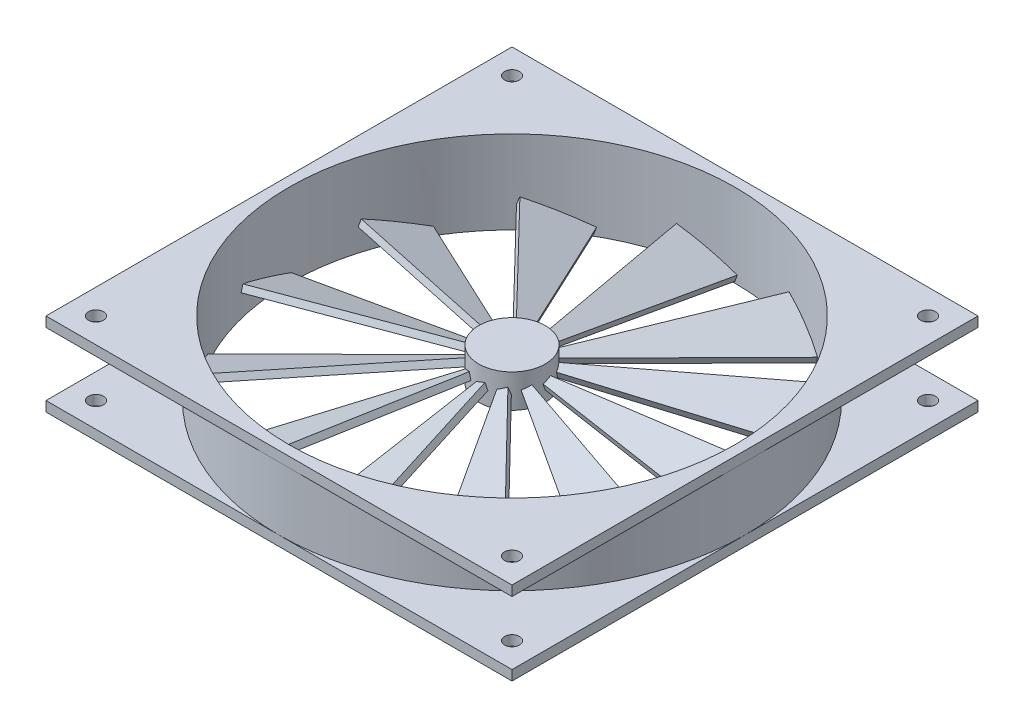
from build123d import *

# Parameters (mm, degrees)
SKETCH2_OUTSIDE_W         = 258.79
SKETCH2_OUTSIDE_H         = 258.79
SKETCH2_OUTSIDE_W_2       = 140
SKETCH2_OUTSIDE_H_2       = 140
SQUARE_SHAPE_CUTOUT_DEPTH = 144.614066163
MOUNTING_HOLES_START      = -12.5
MOUNTING_HOLES_OUTLINE_R  = 2.25
MOUNTING_HOLES_DEPTH      = 25
FAN_WING_DEPTH            = 2
BOSS_EXTRUDE2_DEPTH       = 5
BOSS_EXTRUDE2_DEPTH_BACK  = 5
SKETCH7_R                 = 10
CIRPATTERN3_COUNT         = 12


# Read off the part's stored shape, not the designer's step: mounting_holes
with BuildPart() as part:
    # Sketch1 → body (revolve)
    with BuildSketch(Plane.XY, mode=Mode.PRIVATE) as body_sk:
        Polygon((67, -12.5), (100, -12.5), (100, -9.5), (70, -9.5), (70, 9.5), (100, 9.5), (100, 12.5), (67, 12.5), align=None)
    revolve(body_sk.sketch.rotate(Axis((0, 0, 0), (0, 1, 0)), 90), axis=Axis((0, 0, 0), (0, 1, 0)))

    # Sketch2 outside → square_shape_cutout (cut, through all)
    with BuildSketch(Plane(origin=(0, 12.5, 0), x_dir=(1, 0, 0), z_dir=(0, 1, 0))):
        Rectangle(SKETCH2_OUTSIDE_W, SKETCH2_OUTSIDE_H)
        Rectangle(SKETCH2_OUTSIDE_W_2, SKETCH2_OUTSIDE_H_2, mode=Mode.SUBTRACT)
    extrude(amount=-SQUARE_SHAPE_CUTOUT_DEPTH, mode=Mode.SUBTRACT)

    # mounting_holes outline → mounting_holes (cut)
    with BuildSketch(Plane(origin=(0, 0, 0), x_dir=(1, 0, 0), z_dir=(0, 1, 0)).offset(MOUNTING_HOLES_START)):
        with Locations((62.5, 62.5)):
            Circle(MOUNTING_HOLES_OUTLINE_R)
        with Locations((-62.5, -62.5)):
            Circle(MOUNTING_HOLES_OUTLINE_R)
        with Locations((62.5, -62.5)):
            Circle(MOUNTING_HOLES_OUTLINE_R)
        with Locations((-62.5, 62.5)):
            Circle(MOUNTING_HOLES_OUTLINE_R)
    extrude(amount=MOUNTING_HOLES_DEPTH, mode=Mode.SUBTRACT)

    # Sketch6 → fan_wing (add)
    with BuildSketch(Plane(origin=(0, 0, 0), x_dir=(0.9433922826162455, -0.3265140162330641, 0.058306074327332945), z_dir=(0.33167906340332987, 0.9287013775293232, -0.16583953170166502))):
        with BuildLine():
            Line((0, 0), (0, 68.153777936))
            ThreePointArc((0, 68.153777936), (-8.870280209, 67.459789157), (-17.540404137, 65.461679426))
            Line((-17.540404137, 65.461679426), (0, 0))
        make_face()
    fan_wing = extrude(amount=FAN_WING_DEPTH)

    # Sketch7 → Boss-Extrude2 (add, two sides: drawn at the far end of the back side and taken through both)
    with BuildSketch(Plane(origin=(0, 0, 0), x_dir=(1, 0, 0), z_dir=(0, 1, 0)).offset(-BOSS_EXTRUDE2_DEPTH_BACK)):
        with Locations(Location((0, 0, 0), (0, 0, 270))):
            Circle(SKETCH7_R)
    extrude(amount=BOSS_EXTRUDE2_DEPTH + BOSS_EXTRUDE2_DEPTH_BACK)

    # CirPattern3: fan_wing ×12 about axis
    cirpattern3_axis = Axis((0, 0, 0), (0, 1, 0))
    for i in range(1, CIRPATTERN3_COUNT):
        add(fan_wing.rotate(cirpattern3_axis, i * 360 / CIRPATTERN3_COUNT))


solid = part.part
